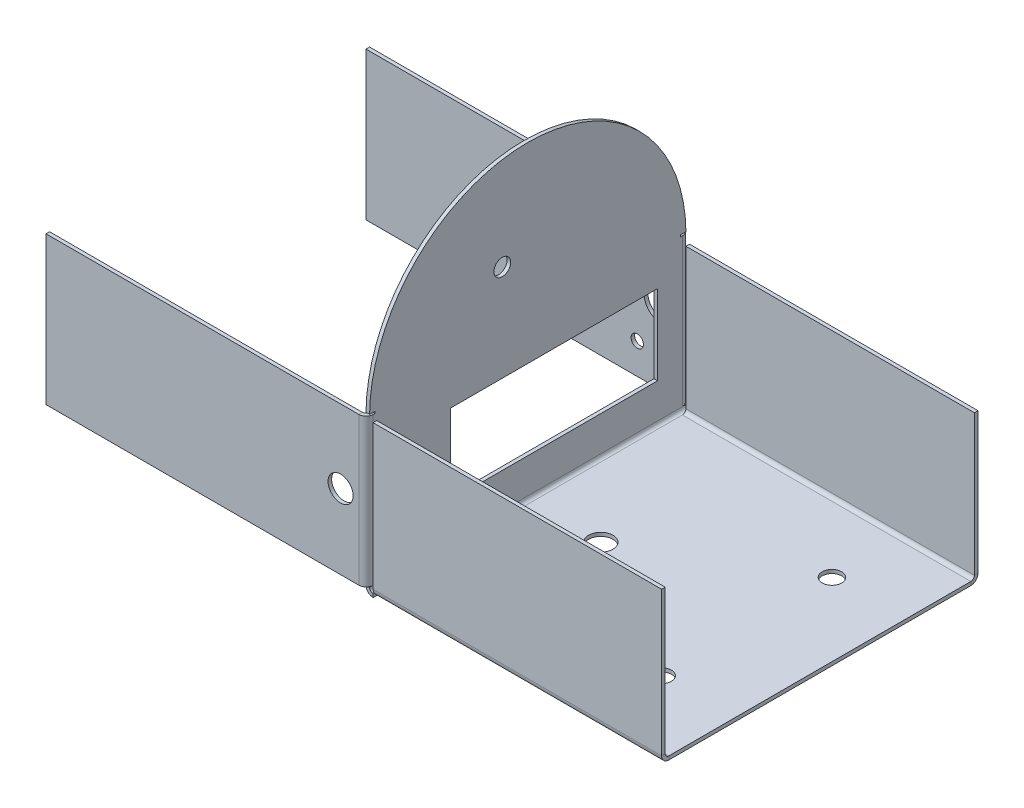
from build123d import *

# Parameters (mm, degrees)
SKETCH1_R                    = 2.5
BASE_FLANGE3_DEPTH           = 0.7366
SKETCHED_START               = -64
SKETCHED_BEND1_OUTLINE_W     = 0.7366
SKETCHED_BEND1_OUTLINE_H     = 65
SKETCHED_BEND1_DEPTH         = 64.108877104
SKETCHED_START_2             = 0.168203781
SKETCHED_BEND1_2_DEPTH       = 0.525916755
SKETCHED_START_3             = -0.042479464
SKETCHED_BEND1_3_DEPTH       = 1.4732
SKETCHED_START_4             = -32.5
SKETCHED_BEND1_4_DEPTH       = 65
EDGE_FLANGE1_START           = 0.7366
EDGE_FLANGE1_DEPTH           = 30.75756821
EDGE_FLANGE1_START_2         = 31.12586821
EDGE_FLANGE1_2_DEPTH         = 0.3683
EDGE_FLANGE1_3_DEPTH         = 30.38926821
SKETCH19_R                   = 1.27
SKETCH19_R_2                 = 3.3749
CUT_EXTRUDE5_DEPTH           = 112.820280988
SKETCH20_W                   = 42.572846016
SKETCH20_H                   = 16.402646855
CUT_EXTRUDE6_DEPTH           = 98.335621766
EDGE_FLANGE2_START           = 0.7366
EDGE_FLANGE2_DEPTH           = 30.75756821
EDGE_FLANGE2_START_2         = 31.12586821
EDGE_FLANGE2_2_DEPTH         = 0.3683
EDGE_FLANGE2_3_DEPTH         = 30.38926821
SKETCH27_R                   = 2.575
CUT_EXTRUDE7_DEPTH           = 10
CUT_EXTRUDE8_DEPTH           = 98.335621766
CUT_EXTRUDE8_DEPTH_BACK      = 98.335621766
SKETCH28_R                   = 1.725
SKETCH33_W                   = 30
SKETCH33_H                   = 65
SKETCH33_R                   = 2
TAB1_DEPTH                   = 0.7366
EDGE_FLANGE3_STRIP_W         = 4.4196
EDGE_FLANGE3_STRIP_H         = 0.7366
EDGE_FLANGE3_STRIP_CUT_DEPTH = 59.2634
EDGE_FLANGE3_DEPTH           = 59.2634
EDGE_FLANGE4_STRIP_W         = 4.4196
EDGE_FLANGE4_STRIP_H         = 0.7366
EDGE_FLANGE4_STRIP_CUT_DEPTH = 59.2634
EDGE_FLANGE4_DEPTH           = 59.2634


with BuildPart() as part:
    # Base-Flange3: sheet metal written as solids
    # Sketch1 → Base-Flange3 (new body)
    with BuildSketch(Plane(origin=(0, 0, 0), x_dir=(1, 0, 0), z_dir=(0, 1, 0))):
        with BuildLine():
            Line((-30.694120536, 32.5), (30.694120536, 32.5))
            Line((30.694120536, 32.5), (30.694120536, -32.5))
            Line((30.694120536, -32.5), (-30.694120536, -32.5))
            ThreePointArc((-30.694120536, -32.5), (-63.194120536, 0), (-30.694120536, 32.5))
        make_face()
        with Locations(Location((15.694120536, 0, 0), (0, 0, 270))):
            Circle(SKETCH1_R, mode=Mode.SUBTRACT)
    extrude(amount=-BASE_FLANGE3_DEPTH)

    # Sketched Bend1: read off the stored shape, not the designer's step
    # Sketched Bend1 outline → Sketched Bend1 (cut)
    with BuildSketch(Plane.YZ.offset(SKETCHED_START)):
        with Locations((-0.3683, 0)):
            Rectangle(SKETCHED_BEND1_OUTLINE_W, SKETCHED_BEND1_OUTLINE_H)
    extrude(amount=SKETCHED_BEND1_DEPTH, mode=Mode.SUBTRACT)

    # Sketched Bend1 2 outline → Sketched Bend1 2 (add)
    with BuildSketch(Plane.YZ.offset(SKETCHED_START_2)):
        with BuildLine():
            ThreePointArc((31.12586821, -32.5), (63.62586821, 0), (31.12586821, 32.5))
            Line((31.12586821, 32.5), (0, 32.5))
            Line((0, 32.5), (0, -32.5))
            Line((0, -32.5), (31.12586821, -32.5))
        make_face()
    extrude(amount=SKETCHED_BEND1_2_DEPTH)

    # Sketched Bend1 3 outline → Sketched Bend1 3 (add)
    with BuildSketch(Plane.YZ.offset(SKETCHED_START_3)):
        with BuildLine():
            ThreePointArc((31.12586821, -32.5), (63.62586821, 0), (31.12586821, 32.5))
            Line((31.12586821, 32.5), (0, 32.5))
            Line((0, 32.5), (0, -32.5))
            Line((0, -32.5), (31.12586821, -32.5))
        make_face()
    extrude(amount=SKETCHED_BEND1_3_DEPTH)

    # Sketched Bend1 4 outline → Sketched Bend1 4 (cut)
    with BuildSketch(Plane.XY.offset(SKETCHED_START_4)):
        with BuildLine():
            Line((0.694120536, 65), (0.694120536, 0.7366))
            ThreePointArc((0.694120536, 0.7366), (0.90986568, 0.215745144), (1.430720536, 0))
            Line((1.430720536, 0), (1.430720536, 65))
            Line((1.430720536, 65), (0.694120536, 65))
        make_face()
        with BuildLine():
            Line((-0.042479464, 0.7366), (-0.042479396, 65))
            Line((-0.042479396, 65), (-2, 65))
            Line((-2, 65), (-2, 0))
            Line((-2, 0), (0.108877104, 0))
            Line((0.108877104, 0), (0.108877104, -2))
            Line((0.108877104, -2), (32, -2))
            Line((32, -2), (32, -0.736599968))
            Line((32, -0.736599968), (1.430720536, -0.7366))
            ThreePointArc((1.430720536, -0.7366), (0.389010825, -0.30510971), (-0.042479464, 0.7366))
        make_face()
    extrude(amount=SKETCHED_BEND1_4_DEPTH, mode=Mode.SUBTRACT)

    # Edge-Flange1: read off the stored shape, not the designer's step
    # Edge-Flange1 outline → Edge-Flange1 (cut)
    with BuildSketch(Plane(origin=(0, 0, 0), x_dir=(1, 0, 0), z_dir=(0, 1, 0)).offset(EDGE_FLANGE1_START)):
        with BuildLine():
            ThreePointArc((0.496749161, 32.5), (0.643922463, 32.144692217), (0.694120536, 31.7634))
            Line((0.694120536, 31.7634), (0.694120536, 32.5))
            Line((0.694120536, 32.5), (0.496749161, 32.5))
        make_face()
    extrude(amount=EDGE_FLANGE1_DEPTH, mode=Mode.SUBTRACT)

    # Edge-Flange1 2 outline → Edge-Flange1 2 (cut)
    with BuildSketch(Plane(origin=(0, 0, 0), x_dir=(1, 0, 0), z_dir=(0, 1, 0)).offset(EDGE_FLANGE1_START_2)):
        with BuildLine():
            Line((-0.042479464, 31.3951), (0.694120536, 31.3951))
            Line((0.694120536, 31.3951), (0.694120536, 31.7634))
            ThreePointArc((0.694120536, 31.7634), (0.643922463, 32.144692217), (0.496749161, 32.5))
            Line((0.496749161, 32.5), (-0.042479464, 32.5))
            Line((-0.042479464, 32.5), (-0.042479464, 31.3951))
        make_face()
    extrude(amount=EDGE_FLANGE1_2_DEPTH, mode=Mode.SUBTRACT)

    # Edge-Flange1 3 outline → Edge-Flange1 3 (add)
    with BuildSketch(Plane(origin=(0, 0, 0), x_dir=(1, 0, 0), z_dir=(0, 1, 0)).offset(EDGE_FLANGE1_START)):
        with BuildLine():
            ThreePointArc((-0.779079464, 32.5), (-0.258224609, 32.284254855), (-0.042479464, 31.7634))
            Line((-0.042479464, 31.7634), (-0.042479464, 32.5))
            Line((-0.042479464, 32.5), (0.496749161, 32.5))
            ThreePointArc((0.496749161, 32.5), (-0.042479464, 33.039228625), (-0.779079464, 33.2366))
            Line((-0.779079464, 33.2366), (-65.042479464, 33.2366))
            Line((-65.042479464, 33.2366), (-65.042479464, 32.5))
            Line((-65.042479464, 32.5), (-0.779079464, 32.5))
        make_face()
    extrude(amount=EDGE_FLANGE1_3_DEPTH)

    # Sketch19 → Cut-Extrude5 (cut, through all)
    with BuildSketch(Plane.XY.offset(-32.5)):
        with Locations((-24.096722092, 26.469477583)):
            Circle(SKETCH19_R)
        with Locations((-9.310652066, 7.044552475)):
            Circle(SKETCH19_R)
        with Locations((-4.517479464, 16.06042365)):
            Circle(SKETCH19_R_2)
    extrude(amount=-CUT_EXTRUDE5_DEPTH, mode=Mode.SUBTRACT)

    # Sketch20 → Cut-Extrude6 (cut, through all)
    with BuildSketch(Plane(origin=(0.694120536, 0, 0), x_dir=(0, 0, -1), z_dir=(1, 0, 0))):
        with Locations((5.381444798, 16.092801871)):
            Rectangle(SKETCH20_W, SKETCH20_H)
    extrude(amount=-CUT_EXTRUDE6_DEPTH, mode=Mode.SUBTRACT)

    # Edge-Flange2: read off the stored shape, not the designer's step
    # Edge-Flange2 outline → Edge-Flange2 (cut)
    with BuildSketch(Plane(origin=(0, 0, 0), x_dir=(1, 0, 0), z_dir=(0, 1, 0)).offset(EDGE_FLANGE2_START)):
        with BuildLine():
            ThreePointArc((0.694120536, -31.7634), (0.643922463, -32.144692217), (0.496749161, -32.5))
            Line((0.496749161, -32.5), (0.694120536, -32.5))
            Line((0.694120536, -32.5), (0.694120536, -31.7634))
        make_face()
    extrude(amount=EDGE_FLANGE2_DEPTH, mode=Mode.SUBTRACT)

    # Edge-Flange2 2 outline → Edge-Flange2 2 (cut)
    with BuildSketch(Plane(origin=(0, 0, 0), x_dir=(1, 0, 0), z_dir=(0, 1, 0)).offset(EDGE_FLANGE2_START_2)):
        with BuildLine():
            Line((-0.042479464, -31.3951), (-0.042479464, -32.5))
            Line((-0.042479464, -32.5), (0.496749161, -32.5))
            ThreePointArc((0.496749161, -32.5), (0.643922463, -32.144692217), (0.694120536, -31.7634))
            Line((0.694120536, -31.7634), (0.694120536, -31.3951))
            Line((0.694120536, -31.3951), (-0.042479464, -31.3951))
        make_face()
    extrude(amount=EDGE_FLANGE2_2_DEPTH, mode=Mode.SUBTRACT)

    # Edge-Flange2 3 outline → Edge-Flange2 3 (add)
    with BuildSketch(Plane(origin=(0, 0, 0), x_dir=(1, 0, 0), z_dir=(0, 1, 0)).offset(EDGE_FLANGE2_START)):
        with BuildLine():
            Line((-0.779079464, -32.5), (-65.042479464, -32.5))
            Line((-65.042479464, -32.5), (-65.042479464, -33.2366))
            Line((-65.042479464, -33.2366), (-0.779079464, -33.2366))
            ThreePointArc((-0.779079464, -33.2366), (-0.042479464, -33.039228625), (0.496749161, -32.5))
            Line((0.496749161, -32.5), (-0.042479464, -32.5))
            Line((-0.042479464, -32.5), (-0.042479464, -31.7634))
            ThreePointArc((-0.042479464, -31.7634), (-0.258224609, -32.284254855), (-0.779079464, -32.5))
        make_face()
    extrude(amount=EDGE_FLANGE2_3_DEPTH)

    # Sketch27 → Cut-Extrude7 (cut)
    with BuildSketch(Plane.XY.offset(38.8834)):
        with Locations((-4.517479464, 16.06042365)):
            Circle(SKETCH27_R)
    extrude(amount=-CUT_EXTRUDE7_DEPTH, mode=Mode.SUBTRACT)

    # Sketch28 → Cut-Extrude8 (cut, two sides: drawn at the far end of the back side and taken through both)
    with BuildSketch(Plane(origin=(0.694120536, 0, 0), x_dir=(0, 0, -1), z_dir=(1, 0, 0)).offset(-CUT_EXTRUDE8_DEPTH_BACK)):
        with Locations(Location((-5.239369246, 44.083803898, 0), (0, 0, 270))):
            Circle(SKETCH28_R)
    extrude(amount=CUT_EXTRUDE8_DEPTH + CUT_EXTRUDE8_DEPTH_BACK, mode=Mode.SUBTRACT)

    # Tab1: sheet metal written as solids
    # Sketch33 → Tab1 (add)
    with BuildSketch(Plane(origin=(0, 0, 0), x_dir=(1, 0, 0), z_dir=(0, 1, 0))):
        with Locations((45.694120536, 0)):
            Rectangle(SKETCH33_W, SKETCH33_H)
        with Locations(Location((45.694120536, 17.5, 0), (0, 0, 270))):
            Circle(SKETCH33_R, mode=Mode.SUBTRACT)
        with Locations(Location((45.694120536, -17.5, 0), (0, 0, 270))):
            Circle(SKETCH33_R, mode=Mode.SUBTRACT)
    extrude(amount=-TAB1_DEPTH)

    # Edge-Flange3: sheet metal written as solids
    # Edge-Flange3 strip (on a plane across the edge) → Edge-Flange3 strip cut (cut)
    with BuildSketch(Plane(origin=(1.430720536, 0, 32.5), x_dir=(0, 0, -1), z_dir=(1, 0, 0))):
        with Locations((-0.7366, -0.3683)):
            Rectangle(EDGE_FLANGE3_STRIP_W, EDGE_FLANGE3_STRIP_H)
    extrude(amount=EDGE_FLANGE3_STRIP_CUT_DEPTH, mode=Mode.SUBTRACT)

    # Edge-Flange3 section (on a plane across the edge) → Edge-Flange3 (add)
    with BuildSketch(Plane(origin=(1.430720536, 0, 32.5), x_dir=(0, 0, -1), z_dir=(1, 0, 0))):
        with BuildLine():
            Line((0, 0.7366), (0, 30.39))
            Line((0, 30.39), (0.7366, 30.39))
            Line((0.7366, 30.39), (0.7366, 0.7366))
            ThreePointArc((0.7366, 0.7366), (0.952345145, 0.215745145), (1.4732, 0))
            Line((1.4732, 0), (1.4732, -0.7366))
            ThreePointArc((1.4732, -0.7366), (0.43149029, -0.30510971), (0, 0.7366))
        make_face()
    extrude(amount=EDGE_FLANGE3_DEPTH)

    # Edge-Flange4: sheet metal written as solids
    # Edge-Flange4 strip (on a plane across the edge) → Edge-Flange4 strip cut (cut)
    with BuildSketch(Plane(origin=(60.694120536, 0, -32.5), x_dir=(0, 0, 1), z_dir=(-1, 0, 0))):
        with Locations((-0.7366, -0.3683)):
            Rectangle(EDGE_FLANGE4_STRIP_W, EDGE_FLANGE4_STRIP_H)
    extrude(amount=EDGE_FLANGE4_STRIP_CUT_DEPTH, mode=Mode.SUBTRACT)

    # Edge-Flange4 section (on a plane across the edge) → Edge-Flange4 (add)
    with BuildSketch(Plane(origin=(60.694120536, 0, -32.5), x_dir=(0, 0, 1), z_dir=(-1, 0, 0))):
        with BuildLine():
            Line((0, 0.7366), (0, 29.6534))
            Line((0, 29.6534), (0.7366, 29.6534))
            Line((0.7366, 29.6534), (0.7366, 0.7366))
            ThreePointArc((0.7366, 0.7366), (0.952345145, 0.215745145), (1.4732, 0))
            Line((1.4732, 0), (1.4732, -0.7366))
            ThreePointArc((1.4732, -0.7366), (0.43149029, -0.30510971), (0, 0.7366))
        make_face()
    extrude(amount=EDGE_FLANGE4_DEPTH)


solid = part.part
